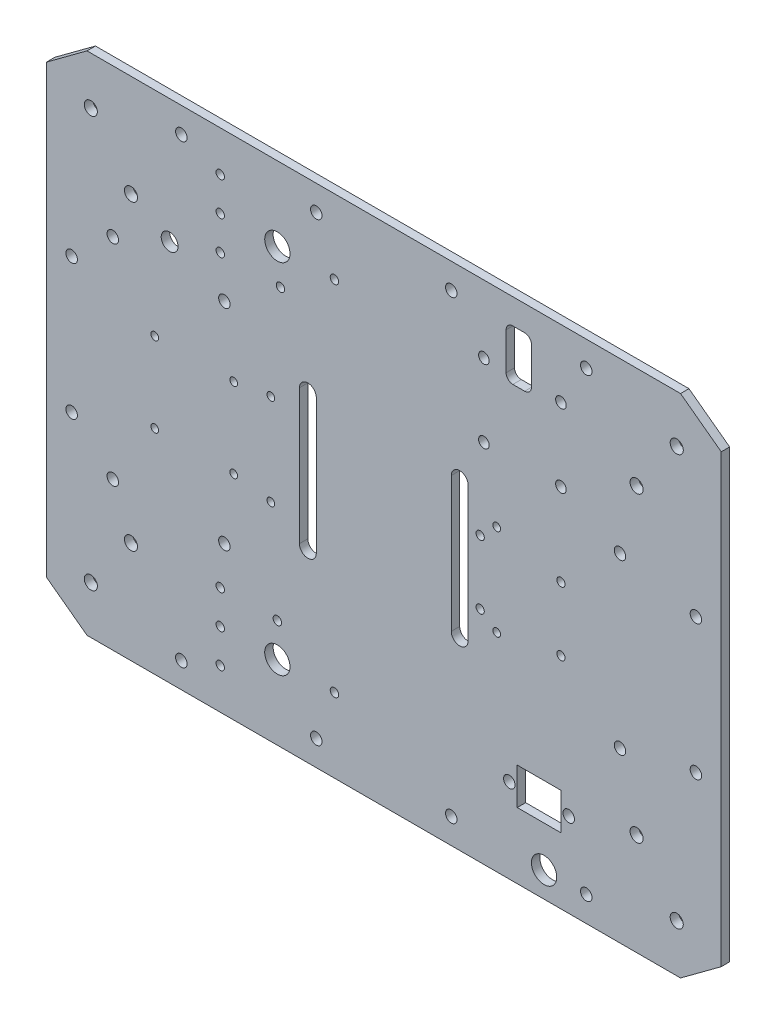
from build123d import *

# Parameters (mm, degrees)
SKETCH1_R                = 2.4638
BOSS_EXTRUDE1_DEPTH      = 3.175
SKETCH2_W                = 16.383
SKETCH2_H                = 13.843
SKETCH2_R                = 2.159
CUT_EXTRUDE1_DEPTH       = 159.781746826
SKETCH5_R                = 3.175
SKETCH5_R_2              = 2.159
SKETCH5_R_3              = 1.4478
CUT_EXTRUDE2_DEPTH       = 159.781746826
SKETCH6_R                = 2.159
CUT_EXTRUDE3_DEPTH       = 159.781746826
SKETCH5_3_R              = 1.45415
CUT_EXTRUDE4_DEPTH       = 159.781746826
SKETCH5_4_R              = 1.5875
SKETCH5_4_R_2            = 4.7625
CUT_EXTRUDE5_DEPTH       = 159.781746826
SKETCH5_5_R              = 1.5875
CUT_EXTRUDE6_DEPTH       = 2.54
SKETCH5_6_R              = 1.5875
CUT_EXTRUDE7_DEPTH       = 159.781746826
CUT_EXTRUDE8_DEPTH       = 7.62
CUT_EXTRUDE8_DEPTH_BACK  = 2.54
SKETCH5_7_W              = 9.525
SKETCH5_7_H              = 19.05
SKETCH5_7_R              = 1.5875
SKETCH5_9_R              = 1.5875
CUT_EXTRUDE9_DEPTH       = 159.781746826
CUT_EXTRUDE17_DEPTH      = 159.781746826
CUT_EXTRUDE17_DEPTH_BACK = 159.781746826
SKETCH5_15_W             = 9.525
SKETCH5_15_H             = 19.05
FILLET1_R                = 2.54
FILLET2_R                = 2.54
FILLET3_R                = 2.54
FILLET4_R                = 2.54
SKETCH9_R                = 1.55
SKETCH9_R_2              = 2
SKETCH9_R_3              = 2.159
CUT_EXTRUDE18_DEPTH      = 159.781746826


with BuildPart() as part:
    # Sketch1 → Boss-Extrude1 (new body)
    with BuildSketch(Plane.XY):
        Polygon((-111.686526805, -95.25), (-127, -83.918625912), (-127, 83.918625912), (-111.686526805, 95.25), (111.686526805, 95.25), (127, 83.918625912), (127, -83.918625912), (111.686526805, -95.25), align=None)
        with Locations((-95.147512794, 56.885632681)):
            Circle(SKETCH1_R, mode=Mode.SUBTRACT)
        with Locations((-110.256011578, 77.303596941)):
            Circle(SKETCH1_R, mode=Mode.SUBTRACT)
        with Locations((110.256011578, 77.303596941)):
            Circle(SKETCH1_R, mode=Mode.SUBTRACT)
        with Locations((95.147512794, 56.885632681)):
            Circle(SKETCH1_R, mode=Mode.SUBTRACT)
        with Locations((-110.256011578, -77.303596941)):
            Circle(SKETCH1_R, mode=Mode.SUBTRACT)
        with Locations((-95.147512794, -56.885632681)):
            Circle(SKETCH1_R, mode=Mode.SUBTRACT)
        with Locations((110.256011578, -77.303596941)):
            Circle(SKETCH1_R, mode=Mode.SUBTRACT)
        with Locations((95.147512794, -56.885632681)):
            Circle(SKETCH1_R, mode=Mode.SUBTRACT)
    extrude(amount=BOSS_EXTRUDE1_DEPTH)

    # Sketch2 → Cut-Extrude1 (cut, through all)
    with BuildSketch(Plane.XY.offset(3.175)):
        with Locations((58.42, -63.5)):
            Rectangle(SKETCH2_W, SKETCH2_H)
        with Locations((69.596, -63.5)):
            Circle(SKETCH2_R)
        with Locations((47.244, -63.5)):
            Circle(SKETCH2_R)
    extrude(amount=-CUT_EXTRUDE1_DEPTH, mode=Mode.SUBTRACT)

    # Sketch5 → Cut-Extrude2 (cut, through all)
    with BuildSketch(Plane(origin=(0, 0, 0), x_dir=(-1, 0, 0), z_dir=(0, 0, -1))):
        with Locations((80.594630637, 48.58004)):
            Circle(SKETCH5_R)
        with Locations((59.995230637, -39.49954)):
            Circle(SKETCH5_R_2)
        with Locations((101.994130637, -39.49954)):
            Circle(SKETCH5_R_2)
        with Locations((101.994130637, 39.49954)):
            Circle(SKETCH5_R_2)
        with Locations((59.995230637, 39.49954)):
            Circle(SKETCH5_R_2)
        with BuildLine():
            Line((-31.75, 25.4), (-31.75, -25.4))
            ThreePointArc((-31.75, -25.4), (-28.575, -28.575), (-25.4, -25.4))
            Line((-25.4, -25.4), (-25.4, 25.4))
            ThreePointArc((-25.4, 25.4), (-28.575, 28.575), (-31.75, 25.4))
        make_face()
        with Locations((86.197426463, 15.03413)):
            Circle(SKETCH5_R_3)
        with Locations((56.479426463, 15.03413)):
            Circle(SKETCH5_R_3)
        with Locations((56.479426463, -15.03413)):
            Circle(SKETCH5_R_3)
        with Locations((86.197426463, -15.03413)):
            Circle(SKETCH5_R_3)
        with BuildLine():
            ThreePointArc((31.75, 25.4), (28.575, 28.575), (25.4, 25.4))
            Line((25.4, 25.4), (25.4, -25.4))
            ThreePointArc((25.4, -25.4), (28.575, -28.575), (31.75, -25.4))
            Line((31.75, -25.4), (31.75, 25.4))
        make_face()
    extrude(amount=-CUT_EXTRUDE2_DEPTH, mode=Mode.SUBTRACT)

    # Sketch6 → Cut-Extrude3 (cut, through all)
    with BuildSketch(Plane(origin=(0, 0, 0), x_dir=(-1, 0, 0), z_dir=(0, 0, -1))):
        with Locations((-76.2, -85.725)):
            Circle(SKETCH6_R)
        with Locations((-25.4, -85.725)):
            Circle(SKETCH6_R)
        with Locations((25.4, -85.725)):
            Circle(SKETCH6_R)
        with Locations((76.2, -85.725)):
            Circle(SKETCH6_R)
        with Locations((76.2, 85.725)):
            Circle(SKETCH6_R)
        with Locations((25.4, 85.725)):
            Circle(SKETCH6_R)
        with Locations((-25.4, 85.725)):
            Circle(SKETCH6_R)
        with Locations((-76.2, 85.725)):
            Circle(SKETCH6_R)
        with Locations((117.475, -25.4)):
            Circle(SKETCH6_R)
        with Locations((117.475, 25.4)):
            Circle(SKETCH6_R)
        with Locations((-117.475, 25.4)):
            Circle(SKETCH6_R)
        with Locations((-117.475, -25.4)):
            Circle(SKETCH6_R)
    extrude(amount=-CUT_EXTRUDE3_DEPTH, mode=Mode.SUBTRACT)

    # Sketch5<3> → Cut-Extrude4 (cut, through all)
    with BuildSketch(Plane(origin=(0, 0, 0), x_dir=(-1, 0, 0), z_dir=(0, 0, -1))):
        with Locations((-42.5, 17.2)):
            Circle(SKETCH5_3_R)
        with Locations((-42.5, -17.2)):
            Circle(SKETCH5_3_R)
        with Locations((42.5, -17.2)):
            Circle(SKETCH5_3_R)
        with Locations((42.5, 17.2)):
            Circle(SKETCH5_3_R)
    extrude(amount=-CUT_EXTRUDE4_DEPTH, mode=Mode.SUBTRACT)

    # Sketch5<4> → Cut-Extrude5 (cut, through all)
    with BuildSketch(Plane(origin=(0, 0, 0), x_dir=(-1, 0, 0), z_dir=(0, 0, -1))):
        with Locations((61.544630637, -54.61)):
            Circle(SKETCH5_4_R)
        with Locations((61.544630637, -67.31)):
            Circle(SKETCH5_4_R)
        with Locations((-60.325, -85.725)):
            Circle(SKETCH5_4_R_2)
        with Locations((61.544630637, 54.61)):
            Circle(SKETCH5_4_R)
        with Locations((61.544630637, -80.01)):
            Circle(SKETCH5_4_R)
        with Locations((40.055369363, -67.31)):
            Circle(SKETCH5_4_R_2)
        with Locations((61.544630637, 67.31)):
            Circle(SKETCH5_4_R)
        with Locations((61.544630637, 80.01)):
            Circle(SKETCH5_4_R)
        with Locations((40.055369363, 67.31)):
            Circle(SKETCH5_4_R_2)
    extrude(amount=-CUT_EXTRUDE5_DEPTH, mode=Mode.SUBTRACT)

    # Sketch5<5> → Cut-Extrude6 (cut)
    with BuildSketch(Plane(origin=(0, 0, 0), x_dir=(-1, 0, 0), z_dir=(0, 0, -1))):
        with Locations((18.566108088, 67.31)):
            Circle(SKETCH5_5_R)
        with Locations((38.886108088, 54.61)):
            Circle(SKETCH5_5_R)
        with Locations((18.566108088, -67.31)):
            Circle(SKETCH5_5_R)
    extrude(amount=-CUT_EXTRUDE6_DEPTH, mode=Mode.SUBTRACT)

    # Sketch5<6> → Cut-Extrude7 (cut, through all)
    with BuildSketch(Plane(origin=(0, 0, 0), x_dir=(-1, 0, 0), z_dir=(0, 0, -1))):
        with Locations((18.566108088, 67.31)):
            Circle(SKETCH5_6_R)
        with Locations((38.886108088, 54.61)):
            Circle(SKETCH5_6_R)
        with Locations((18.566108088, -67.31)):
            Circle(SKETCH5_6_R)
    extrude(amount=-CUT_EXTRUDE7_DEPTH, mode=Mode.SUBTRACT)

    # Sketch5<7> → Cut-Extrude8 (cut, two sides: drawn at the far end of the back side and taken through both)
    with BuildSketch(Plane(origin=(0, 0, 0), x_dir=(-1, 0, 0), z_dir=(0, 0, -1)).offset(-CUT_EXTRUDE8_DEPTH_BACK)):
        with Locations((-50.8, 76.2)):
            Rectangle(SKETCH5_7_W, SKETCH5_7_H)
        with Locations((40.055369363, -54.61)):
            Circle(SKETCH5_7_R)
    extrude(amount=CUT_EXTRUDE8_DEPTH + CUT_EXTRUDE8_DEPTH_BACK, mode=Mode.SUBTRACT)

    # Sketch5<9> → Cut-Extrude9 (cut, through all)
    with BuildSketch(Plane(origin=(0, 0, 0), x_dir=(-1, 0, 0), z_dir=(0, 0, -1))):
        with Locations((40.055369363, -54.61)):
            Circle(SKETCH5_9_R)
    extrude(amount=-CUT_EXTRUDE9_DEPTH, mode=Mode.SUBTRACT)

    # Sketch5<15> → Cut-Extrude17 (cut, two sides: drawn at the far end of the back side and taken through both)
    with BuildSketch(Plane(origin=(0, 0, 0), x_dir=(-1, 0, 0), z_dir=(0, 0, -1)).offset(-CUT_EXTRUDE17_DEPTH_BACK)):
        with Locations((-50.8, 76.2)):
            Rectangle(SKETCH5_15_W, SKETCH5_15_H)
    extrude(amount=CUT_EXTRUDE17_DEPTH + CUT_EXTRUDE17_DEPTH_BACK, mode=Mode.SUBTRACT)

    # Fillet1
    fillet1_edges = [part.edges().sort_by_distance(p)[0] for p in [
        (55.5625, 85.725, 1.5875),
    ]]
    fillet(fillet1_edges, radius=FILLET1_R)

    # Fillet2
    fillet2_edges = [part.edges().sort_by_distance(p)[0] for p in [
        (46.0375, 85.725, 1.5875),
    ]]
    fillet(fillet2_edges, radius=FILLET2_R)

    # Fillet3
    fillet3_edges = [part.edges().sort_by_distance(p)[0] for p in [
        (46.0375, 66.675, 1.5875),
    ]]
    fillet(fillet3_edges, radius=FILLET3_R)

    # Fillet4
    fillet4_edges = [part.edges().sort_by_distance(p)[0] for p in [
        (55.5625, 66.675, 1.5875),
    ]]
    fillet(fillet4_edges, radius=FILLET4_R)

    # Sketch9 → Cut-Extrude18 (cut, through all)
    with BuildSketch(Plane.XY.offset(3.175)):
        with Locations((36.275, 11.3)):
            Circle(SKETCH9_R)
        with Locations((66.675, 11.3)):
            Circle(SKETCH9_R)
        with Locations((66.675, -12.7)):
            Circle(SKETCH9_R)
        with Locations((36.275, -12.7)):
            Circle(SKETCH9_R)
        with Locations((66.675, 69.85)):
            Circle(SKETCH9_R_2)
        with Locations((37.675, 69.85)):
            Circle(SKETCH9_R_2)
        with Locations((37.675, 42.35)):
            Circle(SKETCH9_R_2)
        with Locations((66.675, 42.35)):
            Circle(SKETCH9_R_2)
        with Locations((88.9, 31.75)):
            Circle(SKETCH9_R_3)
        with Locations((88.9, -31.75)):
            Circle(SKETCH9_R_3)
    extrude(amount=-CUT_EXTRUDE18_DEPTH, mode=Mode.SUBTRACT)


solid = part.part
